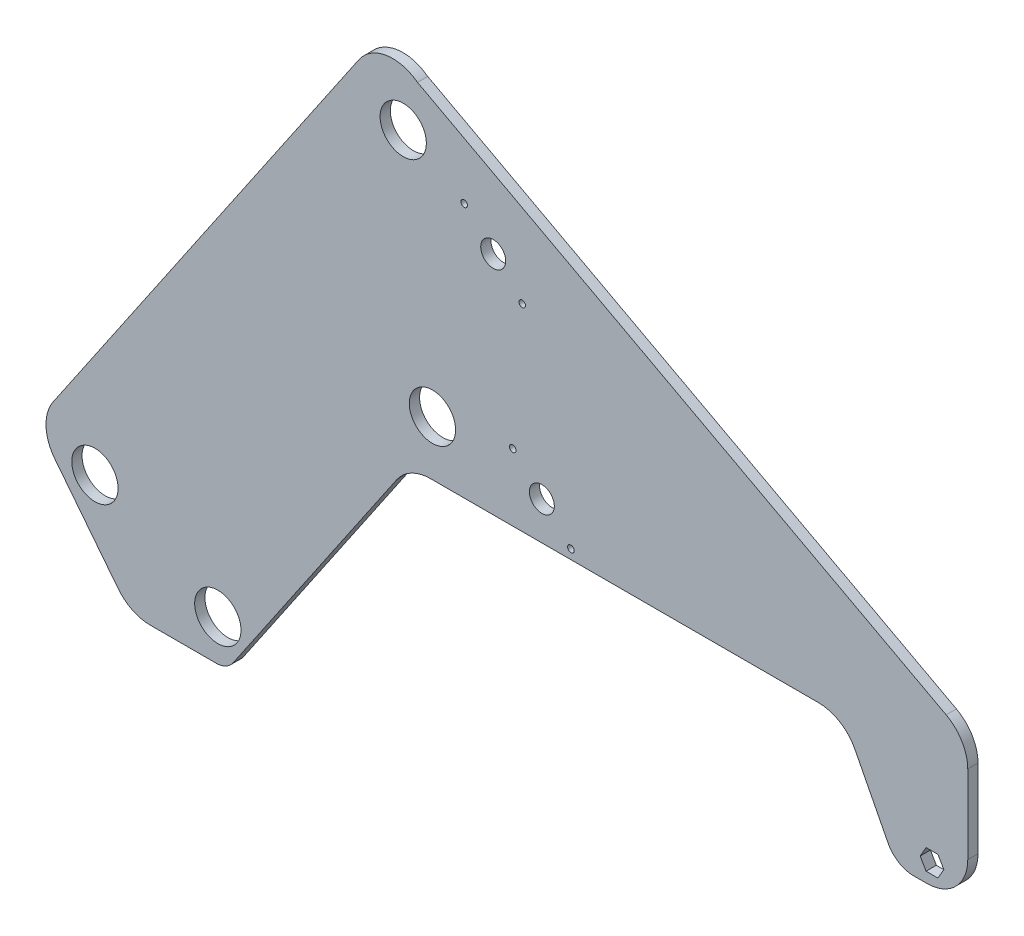
from build123d import *

# Parameters (mm, degrees)
MODEL_R             = 14.351
MODEL_R_2           = 2.032
MODEL_R_3           = 7.747
BOSS_EXTRUDE1_DEPTH = 6.35


with BuildPart() as part:
    # Model → Boss-Extrude1 (new body)
    with BuildSketch(Plane.XY):
        with BuildLine():
            ThreePointArc((-212.899365952, 93.541257838), (-203.778989185, 101.701881024), (-191.901103209, 104.650248016))
            Line((-191.901103209, 104.650248016), (48.661197018, 104.650248016))
            ThreePointArc((48.661197018, 104.650248016), (61.901986038, 100.926075708), (71.260020742, 90.8456422))
            Line((71.260020742, 90.8456422), (91.800416921, 50.813472087))
            ThreePointArc((91.800416921, 50.813472087), (98.351041215, 43.757168632), (107.619593528, 41.150248016))
            Line((107.619593528, 41.150248016), (115.808590566, 41.150248016))
            ThreePointArc((115.808590566, 41.150248016), (133.769102808, 48.589735774), (141.208590566, 66.550248016))
            Line((141.208590566, 66.550248016), (141.208590566, 115.30333804))
            ThreePointArc((141.208590566, 115.30333804), (137.602779127, 128.348388632), (127.809114586, 137.689660276))
            Line((127.809114586, 137.689660276), (-199.949582693, 313.389629113))
            ThreePointArc((-199.949582693, 313.389629113), (-219.402189514, 318.224062751), (-236.303247901, 307.447705012))
            Line((-236.303247901, 307.447705012), (-425.920878295, 28.83612519))
            ThreePointArc((-425.920878295, 28.83612519), (-430.307847502, 13.679090678), (-424.898106806, -1.14372618))
            Line((-424.898106806, -1.14372618), (-385.58146606, -51.20282143))
            ThreePointArc((-385.58146606, -51.20282143), (-376.71145599, -58.357541068), (-365.605974805, -60.913979882))
            Line((-365.605974805, -60.913979882), (-324.737451002, -60.913979882))
            ThreePointArc((-324.737451002, -60.913979882), (-318.798508014, -59.439796386), (-314.23831963, -55.359484793))
            Line((-314.23831963, -55.359484793), (-212.899365952, 93.541257838))
        make_face()
        with Locations((-323.775189267, -35.513979882)):
            Circle(MODEL_R, mode=Mode.SUBTRACT)
        with Locations((-399.975189267, 2.586020118)):
            Circle(MODEL_R, mode=Mode.SUBTRACT)
        with BuildLine():
            ThreePointArc((-106.906627247, 110.457357488), (-106.315772458, 111.902007888), (-104.874663217, 112.501447888))
            ThreePointArc((-104.874663217, 112.501447888), (-103.433553975, 109.036887888), (-106.906627247, 110.457357488))
        make_face(mode=Mode.SUBTRACT)
        Polygon((122.716975548, 60.200248016), (126.383149757, 53.850248016), (122.716975548, 47.500248016), (115.384627129, 47.500248016), (111.71845292, 53.850248016), (115.384627129, 60.200248016), align=None, mode=Mode.SUBTRACT)
        with Locations((-190.707148919, 138.516914683)):
            Circle(MODEL_R, mode=Mode.SUBTRACT)
        with Locations((-140.902394258, 146.283447888)):
            Circle(MODEL_R_2, mode=Mode.SUBTRACT)
        with Locations((-122.888528737, 128.249447888)):
            Circle(MODEL_R_3, mode=Mode.SUBTRACT)
        with BuildLine():
            ThreePointArc((-137.040511204, 226.962594218), (-136.449656415, 228.407244618), (-135.008547173, 229.006684618))
            ThreePointArc((-135.008547173, 229.006684618), (-133.567437931, 225.542124618), (-137.040511204, 226.962594218))
        make_face(mode=Mode.SUBTRACT)
        with Locations((-153.022412694, 244.754684618)):
            Circle(MODEL_R_3, mode=Mode.SUBTRACT)
        with Locations((-171.036278215, 262.788684618)):
            Circle(MODEL_R_2, mode=Mode.SUBTRACT)
        with Locations((-208.832932893, 283.437784316)):
            Circle(MODEL_R, mode=Mode.SUBTRACT)
    extrude(amount=BOSS_EXTRUDE1_DEPTH)


solid = part.part
